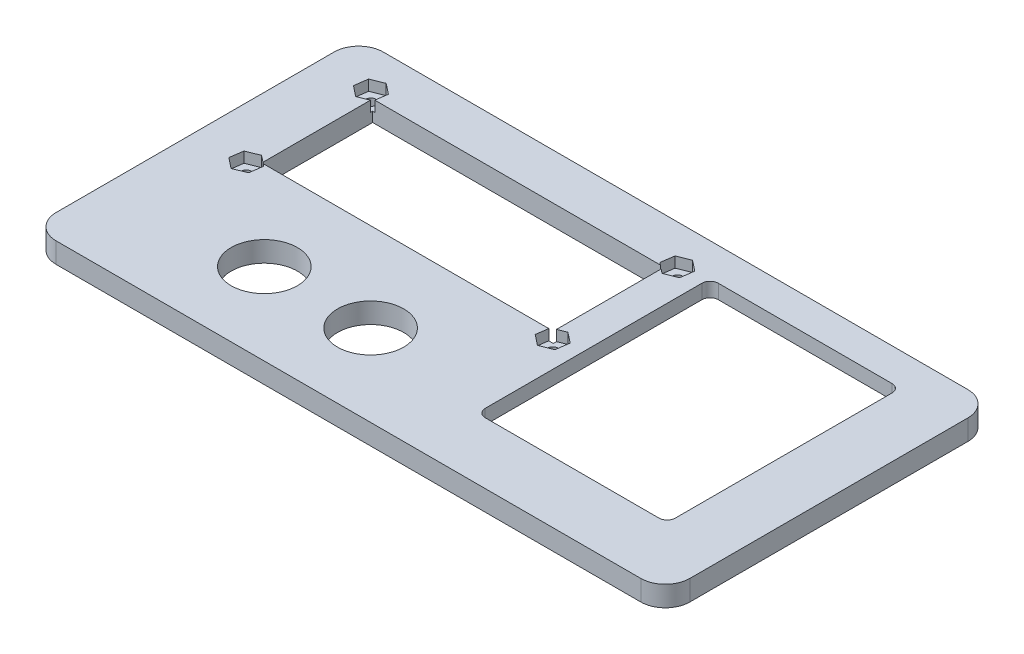
from build123d import *

# Parameters (mm, degrees)
SKETCH1_W                = 155
SKETCH1_H                = 80
BOSS_EXTRUDE1_DEPTH      = 5
SKETCH2_R                = 1.27
SKETCH2_W                = 71.2978
SKETCH2_H                = 27.1018
SCREEN_CUTOUT_DEPTH      = 88.357026048
SCREEN_HEX_NUTS_DEPTH    = 2.6
SKETCH3_R                = 8.1
ULTRASOUND_CUTOUTS_DEPTH = 88.357026048
SKETCH3_3_R              = 8.1
SKETCH3_3_R_2            = 1.190625
CUT_EXTRUDE2_DEPTH       = 3.175
SKETCH5_W                = 12
SKETCH5_H                = 5
US_CLOCK_CUTOUT_DEPTH    = 4
SKETCH6_W                = 10
SKETCH6_H                = 3.5
US_PIN_CUTOUT_DEPTH      = 2
SKETCH9_R                = 3.15
MAGNET_HOLES_DEPTH       = 2.1
FILLET1_R                = 6
SKETCH10_W               = 46.5
SKETCH10_H               = 57
KEYPAD_CUTOUT_DEPTH      = 88.357026048
CUT_EXTRUDE1_DEPTH       = 1.5
FILLET3_R                = 2
FILLET4_R                = 2
SKETCH12_R               = 1.5
CUT_EXTRUDE3_DEPTH       = 2.9


with BuildPart() as part:
    # Sketch1 → Boss-Extrude1 (new body)
    with BuildSketch(Plane(origin=(0, 0, 0), x_dir=(1, 0, 0), z_dir=(0, 1, 0))):
        Rectangle(SKETCH1_W, SKETCH1_H)
    extrude(amount=BOSS_EXTRUDE1_DEPTH)

    # Sketch2 → Screen Cutout (cut, through all)
    with BuildSketch(Plane(origin=(0, 5, 0), x_dir=(1, 0, 0), z_dir=(0, 1, 0))):
        with Locations((-64.96, -0.02)):
            Circle(SKETCH2_R)
        with Locations((9.97, -0.02)):
            Circle(SKETCH2_R)
        with Locations((9.97, 30.46)):
            Circle(SKETCH2_R)
        with Locations((-64.96, 30.46)):
            Circle(SKETCH2_R)
        with Locations((-27.2029, 15.22)):
            Rectangle(SKETCH2_W, SKETCH2_H)
    extrude(amount=-SCREEN_CUTOUT_DEPTH, mode=Mode.SUBTRACT)

    # Sketch8 → Screen hex nuts (cut)
    with BuildSketch(Plane(origin=(0, 5, 0), x_dir=(1, 0, 0), z_dir=(0, 1, 0))):
        Polygon((-68.013462423, 29.232658469), (-65.423822267, 27.201953207), (-62.370359844, 28.429294738), (-61.906537577, 31.687341531), (-64.496177733, 33.718046793), (-67.549640156, 32.490705262), align=None)
        Polygon((6.916537856, 29.232657776), (9.506178473, 27.201953102), (12.559640617, 28.429295326), (13.023462144, 31.687342224), (10.433821527, 33.718046898), (7.380359383, 32.490704674), align=None)
        Polygon((6.916537628, -1.247341658), (9.506177869, -3.278046812), (12.559640241, -2.050705154), (13.023462372, 1.207341658), (10.433822131, 3.238046812), (7.380359759, 2.010705154), align=None)
        Polygon((-68.013462387, -1.247341619), (-65.423822172, -3.278046806), (-62.370359785, -2.050705187), (-61.906537613, 1.207341619), (-64.496177828, 3.238046806), (-67.549640215, 2.010705187), align=None)
    extrude(amount=-SCREEN_HEX_NUTS_DEPTH, mode=Mode.SUBTRACT)

    # Sketch3 → Ultrasound Cutouts (cut, through all)
    with BuildSketch(Plane(origin=(0, 0, 0), x_dir=(1, 0, 0), z_dir=(0, 1, 0))):
        with Locations((-40.58183153, -20)):
            Circle(SKETCH3_R)
        with Locations((-14.58183153, -20)):
            Circle(SKETCH3_R)
    extrude(amount=ULTRASOUND_CUTOUTS_DEPTH, mode=Mode.SUBTRACT)

    # Sketch3<3> → Cut-Extrude2 (cut)
    with BuildSketch(Plane(origin=(0, 0, 0), x_dir=(1, 0, 0), z_dir=(0, 1, 0))):
        with Locations((-40.58183153, -20)):
            Circle(SKETCH3_3_R)
        with Locations((-14.58183153, -20)):
            Circle(SKETCH3_3_R)
        with Locations((-48.73183153, -11.45)):
            Circle(SKETCH3_3_R_2)
        with Locations((-6.43183153, -11.45)):
            Circle(SKETCH3_3_R_2)
        with Locations((-6.43183153, -28.55)):
            Circle(SKETCH3_3_R_2)
        with Locations((-48.73183153, -28.55)):
            Circle(SKETCH3_3_R_2)
    extrude(amount=CUT_EXTRUDE2_DEPTH, mode=Mode.SUBTRACT)

    # Sketch5 → US Clock cutout (cut)
    with BuildSketch(Plane.XZ):
        with Locations((-27.471992442, 27.55)):
            Rectangle(SKETCH5_W, SKETCH5_H)
    extrude(amount=-US_CLOCK_CUTOUT_DEPTH, mode=Mode.SUBTRACT)

    # Sketch6 → US Pin cutout (cut)
    with BuildSketch(Plane.XZ):
        with Locations((-27.471992442, 11.55)):
            Rectangle(SKETCH6_W, SKETCH6_H)
    extrude(amount=-US_PIN_CUTOUT_DEPTH, mode=Mode.SUBTRACT)

    # Sketch9 → Magnet Holes (cut)
    with BuildSketch(Plane(origin=(0, 0.2, 0), x_dir=(-1, 0, 0), z_dir=(0, -1, 0))):
        with Locations((-71.5, 34)):
            Circle(SKETCH9_R)
        with Locations((71.5, 34)):
            Circle(SKETCH9_R)
        with Locations((-71.5, -34)):
            Circle(SKETCH9_R)
        with Locations((71.5, -34)):
            Circle(SKETCH9_R)
    extrude(amount=-MAGNET_HOLES_DEPTH, mode=Mode.SUBTRACT)

    # Fillet1
    fillet1_edges = [part.edges().sort_by_distance(p)[0] for p in [
        (77.5, 2.5, -40),
        (77.5, 2.5, 40),
        (-77.5, 2.5, 40),
        (-77.5, 2.5, -40),
    ]]
    fillet(fillet1_edges, radius=FILLET1_R)

    # Sketch10 → Keypad cutout (cut, through all)
    with BuildSketch(Plane(origin=(0, 5, 0), x_dir=(1, 0, 0), z_dir=(0, 1, 0))):
        with Locations((39.696, 3.5)):
            Rectangle(SKETCH10_W, SKETCH10_H)
    extrude(amount=-KEYPAD_CUTOUT_DEPTH, mode=Mode.SUBTRACT)

    # Sketch11 → Cut-Extrude1 (cut)
    with BuildSketch(Plane.XZ):
        Polygon((58.696, 28.5), (58.696, 34.5), (20.696, 34.5), (20.696, 28.5), (13.696, 28.5), (13.696, -35.5), (65.696, -35.5), (65.696, 28.5), align=None)
    extrude(amount=-CUT_EXTRUDE1_DEPTH, mode=Mode.SUBTRACT)

    # Fillet3
    fillet3_edges = [part.edges().sort_by_distance(p)[0] for p in [
        (65.696, 0.75, 28.5),
        (13.696, 0.75, 28.5),
        (13.696, 0.75, -35.5),
        (65.696, 0.75, -35.5),
    ]]
    fillet(fillet3_edges, radius=FILLET3_R)

    # Fillet4
    fillet4_edges = [part.edges().sort_by_distance(p)[0] for p in [
        (62.946, 3.25, 25),
        (16.446, 3.25, 25),
        (16.446, 3.25, -32),
        (62.946, 3.25, -32),
    ]]
    fillet(fillet4_edges, radius=FILLET4_R)

    # Sketch12 → Cut-Extrude3 (cut)
    with BuildSketch(Plane.XZ.offset(-1.5)):
        with Locations((63.092012723, -34.123666466)):
            Circle(SKETCH12_R)
        with Locations((15.839087894, -34.123666466)):
            Circle(SKETCH12_R)
        with Locations((15.839087894, 26.403006737)):
            Circle(SKETCH12_R)
        with Locations((63.092012723, 26.403006737)):
            Circle(SKETCH12_R)
    extrude(amount=-CUT_EXTRUDE3_DEPTH, mode=Mode.SUBTRACT)


solid = part.part
